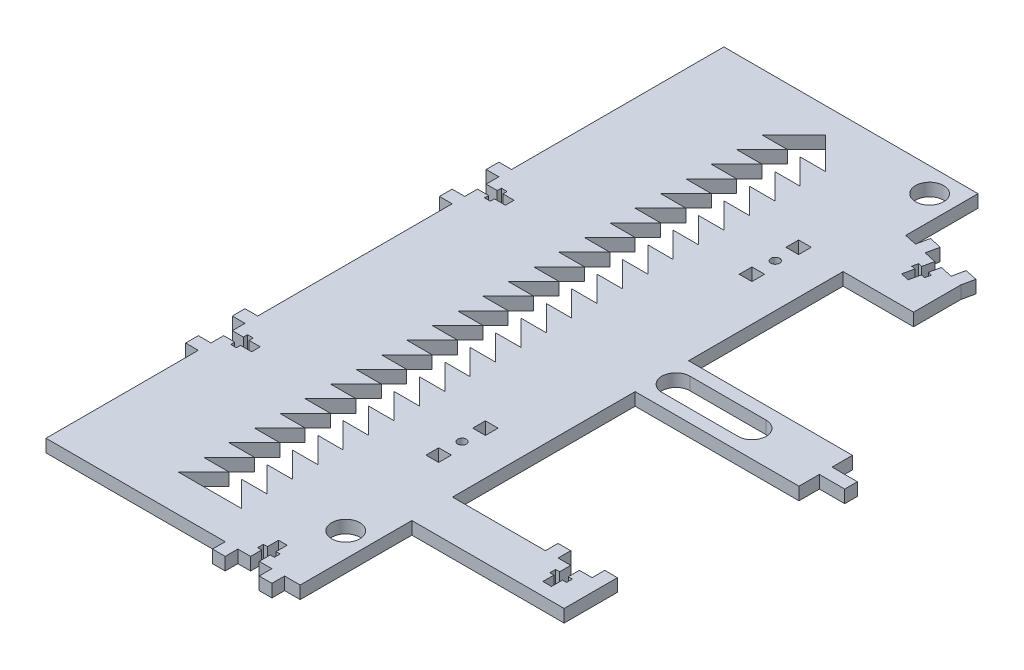
from build123d import *

# Parameters (mm, degrees)
AXLE_SUPPORT_PLATE_W   = 6.35
AXLE_SUPPORT_PLATE_H   = 6.35
AXLE_SUPPORT_PLATE_R   = 2.159
AXLE_SUPPORT_PLATE_R_2 = 7.030128061
BOSS_EXTRUDE1_DEPTH    = 6.35
BOSS_EXTRUDE2_DEPTH    = 6.35


with BuildPart() as part:
    # Axle Support Plate → Boss-Extrude1 (new body)
    with BuildSketch(Plane(origin=(0, 0, 0), x_dir=(1, 0, 0), z_dir=(0, 1, 0))):
        Polygon((55.79393597, -169.56756403), (63.58606403, -169.56756403), (63.58606403, -113.68756403), (139.78606403, -113.68756403), (139.78606403, -93.36756403), (139.78606403, -87.01756403), (133.43606403, -87.01756403), (133.43606403, -93.36756403), (127.08606403, -93.36756403), (127.08606403, -98.902564009), (129.127064012, -98.902564009), (129.127064012, -101.802564051), (127.08606403, -101.802564051), (127.08606403, -107.33756403), (122.76806403, -107.33756403), (122.76806403, -101.802564051), (120.727064048, -101.802564051), (120.727064048, -98.902564009), (122.76806403, -98.902564009), (122.76806403, -93.36756403), (116.41806403, -93.36756403), (116.41806403, -87.01756403), (110.06806403, -87.01756403), (110.06806403, -93.36756403), (63.58606403, -93.36756403), (63.58606403, -1.972692091), (145.546192091, -1.972692091), (145.546192091, 8.23243597), (158.246192091, 8.23243597), (158.246192091, 14.58243597), (145.546192091, 14.58243597), (145.546192091, 24.78756403), (63.58606403, 24.78756403), (63.58606403, 169.56756403), (-63.58606403, 169.56756403), (-63.58606403, 63.35043597), (-69.93606403, 63.35043597), (-69.93606403, 57.00043597), (-63.58606403, 57.00043597), (-63.58606403, 50.65043597), (-58.051064051, 50.65043597), (-58.051064051, 52.691435952), (-55.151064009, 52.691435952), (-55.151064009, 50.65043597), (-49.61606403, 50.65043597), (-49.61606403, 46.33243597), (-55.151064009, 46.33243597), (-55.151064009, 44.291435988), (-58.051064051, 44.291435988), (-58.051064051, 46.33243597), (-63.58606403, 46.33243597), (-63.58606403, 39.98243597), (-69.93606403, 39.98243597), (-69.93606403, 33.63243597), (-63.58606403, 33.63243597), (-63.58606403, -63.64956403), (-69.93606403, -63.64956403), (-69.93606403, -69.99956403), (-63.58606403, -69.99956403), (-63.58606403, -76.34956403), (-58.051064051, -76.34956403), (-58.051064051, -74.308564048), (-55.151064009, -74.308564048), (-55.151064009, -76.34956403), (-49.61606403, -76.34956403), (-49.61606403, -80.66756403), (-55.151064009, -80.66756403), (-55.151064009, -82.708564012), (-58.051064051, -82.708564012), (-58.051064051, -80.66756403), (-63.58606403, -80.66756403), (-63.58606403, -87.01756403), (-69.93606403, -87.01756403), (-69.93606403, -93.36756403), (-63.58606403, -93.36756403), (-63.58606403, -169.56756403), (26.07593597, -169.56756403), (26.07593597, -175.91756403), (32.42593597, -175.91756403), (32.42593597, -169.56756403), (38.77593597, -169.56756403), (38.77593597, -164.032564051), (36.734935988, -164.032564051), (36.734935988, -161.132564009), (38.77593597, -161.132564009), (38.77593597, -155.59756403), (43.09393597, -155.59756403), (43.09393597, -161.132564009), (45.134935952, -161.132564009), (45.134935952, -164.032564051), (43.09393597, -164.032564051), (43.09393597, -169.56756403), (49.44393597, -169.56756403), (49.44393597, -175.91756403), (55.79393597, -175.91756403), align=None)
        with Locations((41.95093597, -78.63556403)):
            Rectangle(AXLE_SUPPORT_PLATE_W, AXLE_SUPPORT_PLATE_H, mode=Mode.SUBTRACT)
        with Locations((41.95093597, -66.95156403)):
            Circle(AXLE_SUPPORT_PLATE_R, mode=Mode.SUBTRACT)
        with Locations((41.95093597, -55.26756403)):
            Rectangle(AXLE_SUPPORT_PLATE_W, AXLE_SUPPORT_PLATE_H, mode=Mode.SUBTRACT)
        with Locations((51.47593597, -134.64256403)):
            Circle(AXLE_SUPPORT_PLATE_R_2, mode=Mode.SUBTRACT)
        Polygon((-15.875, 140.99256403), (0, 156.86756403), (15.875, 140.99256403), (3.175, 140.99256403), (15.875, 128.29256403), (3.175, 128.29256403), (15.875, 115.59256403), (3.175, 115.59256403), (15.875, 102.89256403), (3.175, 102.89256403), (15.875, 90.19256403), (3.175, 90.19256403), (15.875, 77.49256403), (3.175, 77.49256403), (15.875, 64.79256403), (3.175, 64.79256403), (15.875, 52.09256403), (3.175, 52.09256403), (15.875, 39.39256403), (3.175, 39.39256403), (15.875, 26.69256403), (3.175, 26.69256403), (15.875, 13.99256403), (3.175, 13.99256403), (15.875, 1.29256403), (3.175, 1.29256403), (15.875, -11.40743597), (3.175, -11.40743597), (15.875, -24.10743597), (3.175, -24.10743597), (15.875, -36.80743597), (3.175, -36.80743597), (15.875, -49.50743597), (3.175, -49.50743597), (15.875, -62.20743597), (3.175, -62.20743597), (15.875, -74.90743597), (3.175, -74.90743597), (15.875, -87.60743597), (3.175, -87.60743597), (15.875, -100.30743597), (3.175, -100.30743597), (15.875, -113.00743597), (3.175, -113.00743597), (15.875, -125.70743597), (3.175, -125.70743597), (15.875, -138.40743597), (3.175, -138.40743597), (15.875, -151.10743597), (-15.875, -151.10743597), (-3.175, -138.40743597), (-15.875, -138.40743597), (-3.175, -125.70743597), (-15.875, -125.70743597), (-3.175, -113.00743597), (-15.875, -113.00743597), (-3.175, -100.30743597), (-15.875, -100.30743597), (-3.175, -87.60743597), (-15.875, -87.60743597), (-3.175, -74.90743597), (-15.875, -74.90743597), (-3.175, -62.20743597), (-15.875, -62.20743597), (-3.175, -49.50743597), (-15.875, -49.50743597), (-3.175, -36.80743597), (-15.875, -36.80743597), (-3.175, -24.10743597), (-15.875, -24.10743597), (-3.175, -11.40743597), (-15.875, -11.40743597), (-3.175, 1.29256403), (-15.875, 1.29256403), (-3.175, 13.99256403), (-15.875, 13.99256403), (-3.175, 26.69256403), (-15.875, 26.69256403), (-3.175, 39.39256403), (-15.875, 39.39256403), (-3.175, 52.09256403), (-15.875, 52.09256403), (-3.175, 64.79256403), (-15.875, 64.79256403), (-3.175, 77.49256403), (-15.875, 77.49256403), (-3.175, 90.19256403), (-15.875, 90.19256403), (-3.175, 102.89256403), (-15.875, 102.89256403), (-3.175, 115.59256403), (-15.875, 115.59256403), (-3.175, 128.29256403), (-15.875, 128.29256403), (-3.175, 140.99256403), align=None, mode=Mode.SUBTRACT)
        with Locations((41.95093597, 78.08243597)):
            Rectangle(AXLE_SUPPORT_PLATE_W, AXLE_SUPPORT_PLATE_H, mode=Mode.SUBTRACT)
        with Locations((41.95093597, 89.76643597)):
            Circle(AXLE_SUPPORT_PLATE_R, mode=Mode.SUBTRACT)
        with Locations((41.95093597, 101.45043597)):
            Rectangle(AXLE_SUPPORT_PLATE_W, AXLE_SUPPORT_PLATE_H, mode=Mode.SUBTRACT)
        with BuildLine():
            ThreePointArc((70.616192091, 4.377307909), (63.58606403, 11.40743597), (70.616192091, 18.43756403))
            Line((70.616192091, 18.43756403), (108.716192091, 18.43756403))
            ThreePointArc((108.716192091, 18.43756403), (115.746320151, 11.40743597), (108.716192091, 4.377307909))
            Line((108.716192091, 4.377307909), (70.616192091, 4.377307909))
        make_face(mode=Mode.SUBTRACT)
        with Locations((51.47593597, 157.45743597)):
            Circle(AXLE_SUPPORT_PLATE_R_2, mode=Mode.SUBTRACT)
    extrude(amount=BOSS_EXTRUDE1_DEPTH)

    # Sketch1 → Boss-Extrude2 (add)
    with BuildSketch(Plane(origin=(0, 6.35, 0), x_dir=(1, 0, 0), z_dir=(0, 1, 0))):
        Polygon((98.82726602, 102.084752853), (98.82726602, 125.730841214), (100.179102506, 131.935278184), (93.974665536, 133.28711467), (92.62282905, 127.0826777), (86.41839208, 128.434514187), (85.240059021, 123.026394738), (87.234272524, 122.591891077), (86.616898372, 119.758368641), (84.622684869, 120.192872301), (83.44435181, 114.784752853), (79.22533467, 115.704001663), (80.403667729, 121.112121112), (78.409454226, 121.546624772), (79.026828378, 124.380147209), (81.021041881, 123.945643549), (82.19937494, 129.353762997), (75.99493797, 130.705599483), (77.346774456, 136.910036453), (71.142337487, 138.26187294), (69.790501, 132.05743597), (63.58606403, 133.409272456), (63.58606403, 102.084752853), align=None)
    extrude(amount=-BOSS_EXTRUDE2_DEPTH)


solid = part.part
